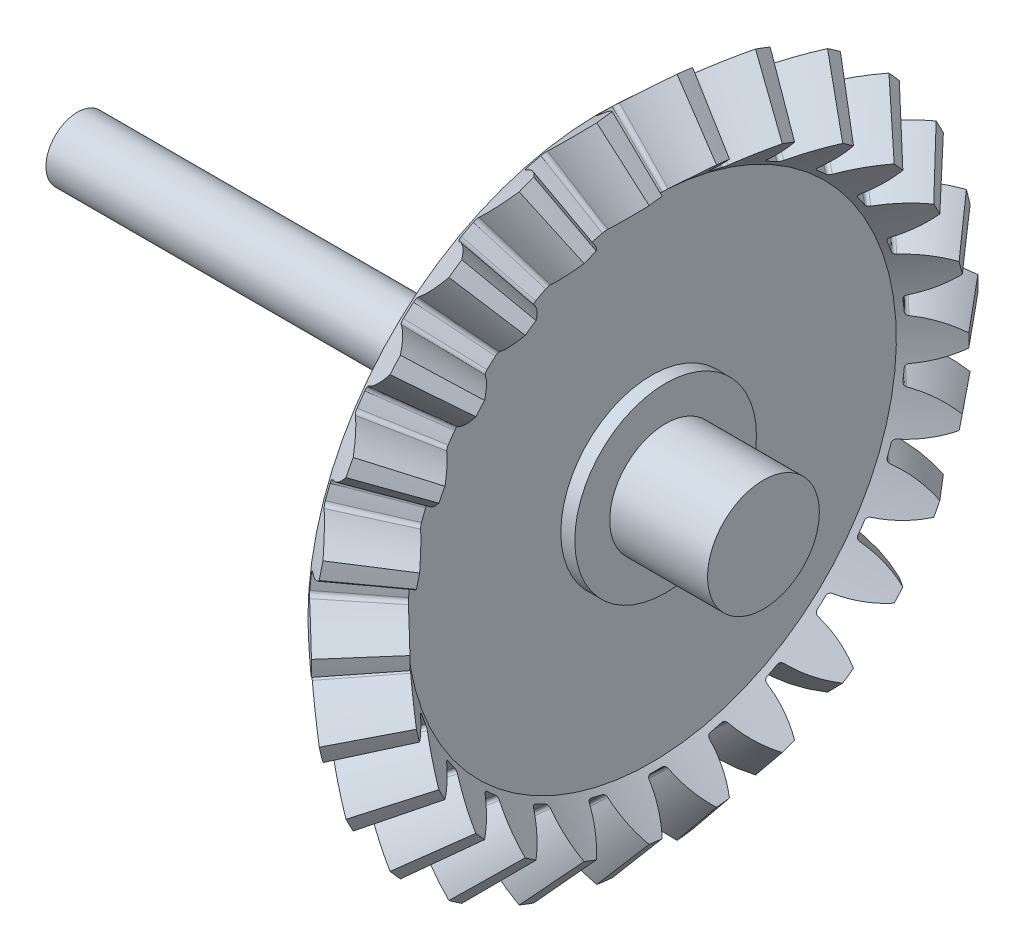
from build123d import *

# Parameters (mm, degrees)
TEETHCUTS_COUNT     = 26
TEETHCUTS_ANGLE     = 346.153846154
HUBSKE_R            = 4
HUB_DEPTH           = 0.0001016
BORSKE_R            = 2.5
BORE_DEPTH          = 23.019917858
SKETCH1_R           = 10
CUT_EXTRUDE1_DEPTH  = 10
SKETCH1_2_R         = 10
BOSS_EXTRUDE1_DEPTH = 3.717599472
SKETCH2_R           = 6.5
BOSS_EXTRUDE2_DEPTH = 1
SKETCH3_R           = 4
BOSS_EXTRUDE3_DEPTH = 7
SKETCH4_R           = 2.25
BOSS_EXTRUDE4_DEPTH = 37.382400528


with BuildPart() as part:
    # BasProSke → Base-Revolve (revolve)
    with BuildSketch(Plane(origin=(0, 0, 0), x_dir=(1, 0, 0), z_dir=(0, 1, 0)), mode=Mode.PRIVATE) as base_revolve_sk:
        Polygon((0, 0), (0, 20.885507333), (3.218270607, 23.856218658), (6.416134622, 20.003552359), (3.717599472, 17.51259684), (3.717599472, 0), align=None)
    revolve(base_revolve_sk.sketch.rotate(Axis((-10, 0, 0), (1, 0, 0)), 180), axis=Axis((-10, 0, 0), (1, 0, 0)))

    # ToothCut: read off the stored shape, not the designer's step
    # ToothCut: loft between two sections, ruled curve by curve
    toothcut_from = [
        Edge.make_bspline([(23.026510041, 0.006131983, -0.008919588), (23.021998953, 0.001967902, -0.015141997), (23.015606807, -0.00393254, -0.014285782), (23.012073699, -0.007193871, -0.00698587)], [0, 0, 0, 0, 1, 1, 1, 1], 3, [1, 0.752816672, 0.752816672, 1]),
        Edge.make_bspline([(23.012073699, -0.007193871, 0.00698587), (23.015606807, -0.00393254, 0.014285782), (23.021998953, 0.001967902, 0.015141997), (23.026510041, 0.006131983, 0.008919588)], [0, 0, 0, 0, 1, 1, 1, 1], 3, [1, 0.752816672, 0.752816672, 1]),
        Edge.make_bspline([(23.012073699, -0.007193871, -0.00698587), (23.011608559, -0.007623231, -0.006024823), (23.01124308, -0.007960597, -0.004987071), (23.010983962, -0.008199782, -0.003891642)], [0, 0, 0, 0, 1, 1, 1, 1], 3, [1, 0.993888935, 0.993888935, 1]),
        Edge.make_bspline([(23.010983962, -0.008199782, 0.003891642), (23.01124308, -0.007960597, 0.004987071), (23.011608559, -0.007623231, 0.006024823), (23.012073699, -0.007193871, 0.00698587)], [0, 0, 0, 0, 1, 1, 1, 1], 3, [1, 0.993888935, 0.993888935, 1]),
        Edge.make_bspline([(23.010983962, -0.008199782, -0.003891642), (23.010380433, -0.008756886, -0.001340195), (23.010380433, -0.008756886, 0.001340195), (23.010983962, -0.008199782, 0.003891642)], [0, 0, 0, 0, 1, 1, 1, 1], 3, [1, 0.967929126, 0.967929126, 1]),
        Edge.make_line((23.026510041, 0.006131983, 0.008919588), (23.026510041, 0.006131983, -0.008919588)),
    ]
    toothcut_to = [
        Edge.make_bspline([(3.473042415, 24.091392634, -2.643476416), (2.631372433, 23.314466498, -1.72385277), (1.653290725, 22.411621846, -1.102597642), (0.594773134, 21.434528687, -0.815265607)], [0, 0, 0, 0, 1, 1, 1, 1], 3, [1, 0.980923256, 0.980923256, 1]),
        Edge.make_bspline([(0.594773134, 21.434528687, 0.815265607), (1.653290725, 22.411621846, 1.102597642), (2.631372433, 23.314466498, 1.72385277), (3.473042415, 24.091392634, 2.643476416)], [0, 0, 0, 0, 1, 1, 1, 1], 3, [1, 0.980923256, 0.980923256, 1]),
        Edge.make_bspline([(0.594773134, 21.434528687, -0.815265607), (0.473914998, 21.322967331, -0.782458958), (0.396885474, 21.251863155, -0.651540855), (0.399787128, 21.254541605, -0.48387062)], [0, 0, 0, 0, 1, 1, 1, 1], 3, [1, 0.843771736, 0.843771736, 1]),
        Edge.make_bspline([(0.399787128, 21.254541605, 0.48387062), (0.396885474, 21.251863155, 0.651540855), (0.473914998, 21.322967331, 0.782458958), (0.594773134, 21.434528687, 0.815265607)], [0, 0, 0, 0, 1, 1, 1, 1], 3, [1, 0.843771736, 0.843771736, 1]),
        Edge.make_bspline([(0.399787128, 21.254541605, -0.48387062), (0.405369098, 21.259694192, -0.161320021), (0.405369098, 21.259694192, 0.161320021), (0.399787128, 21.254541605, 0.48387062)], [0, 0, 0, 0, 1, 1, 1, 1], 3, [1, 0.999815186, 0.999815186, 1]),
        Edge.make_line((3.473042415, 24.091392634, 2.643476416), (3.473042415, 24.091392634, -2.643476416)),
    ]
    toothcut = Solid(Shell([*[Face.make_surface_from_curves(toothcut_from[k], toothcut_to[k]) for k in range(6)], Face(Wire(toothcut_from)), Face(Wire(toothcut_to))]))
    add(toothcut, mode=Mode.SUBTRACT)

    # TeethCuts: ToothCut ×26 about axis
    teethcuts_axis = Axis((-10, 0, 0), (1, 0, 0))
    for i in range(1, TEETHCUTS_COUNT):
        add(toothcut.rotate(teethcuts_axis, i * TEETHCUTS_ANGLE / (TEETHCUTS_COUNT - 1)), mode=Mode.SUBTRACT)

    # HubSke → Hub (add)
    with BuildSketch(Plane.ZY):
        with Locations(Location((0, 0, 0), (0, 0, 180))):
            Circle(HUBSKE_R)
    extrude(amount=HUB_DEPTH)

    # BorSke → Bore (cut, symmetric)
    with BuildSketch(Plane(origin=(0, 0, 0), x_dir=(0, 0, -1), z_dir=(1, 0, 0))):
        with Locations(Location((0, 0, 0), (0, 0, 180))):
            Circle(BORSKE_R)
    extrude(amount=BORE_DEPTH, both=True, mode=Mode.SUBTRACT)

    # Sketch1 → Cut-Extrude1 (cut)
    with BuildSketch(Plane.ZY):
        Circle(SKETCH1_R)
    extrude(amount=-CUT_EXTRUDE1_DEPTH, mode=Mode.SUBTRACT)


with BuildPart() as cut_extrude1_kept_piece:
    # of the separate pieces the step leaves, the one the design keeps (cut_extrude1_pieces_kept)
    add(part.part.solids().sort_by_distance((0, 0, 20.885507333))[0])

    # Sketch1<2> → Boss-Extrude1 (add)
    with BuildSketch(Plane.ZY):
        Circle(SKETCH1_2_R)
    extrude(amount=-BOSS_EXTRUDE1_DEPTH)

    # Sketch2 → Boss-Extrude2 (add)
    with BuildSketch(Plane(origin=(3.717599472, 0, 0), x_dir=(0, 0, -1), z_dir=(1, 0, 0))):
        with Locations(Location((0, 0, 0), (0, 0, 180))):
            Circle(SKETCH2_R)
    extrude(amount=BOSS_EXTRUDE2_DEPTH)

    # Sketch3 → Boss-Extrude3 (add)
    with BuildSketch(Plane(origin=(4.717599472, 0, 0), x_dir=(0, 0, -1), z_dir=(1, 0, 0))):
        Circle(SKETCH3_R)
    extrude(amount=BOSS_EXTRUDE3_DEPTH)

    # Sketch4 → Boss-Extrude4 (add)
    with BuildSketch(Plane.ZY):
        with Locations(Location((0, 0, 0), (0, 0, 180))):
            Circle(SKETCH4_R)
    extrude(amount=BOSS_EXTRUDE4_DEPTH)


solid = cut_extrude1_kept_piece.part
